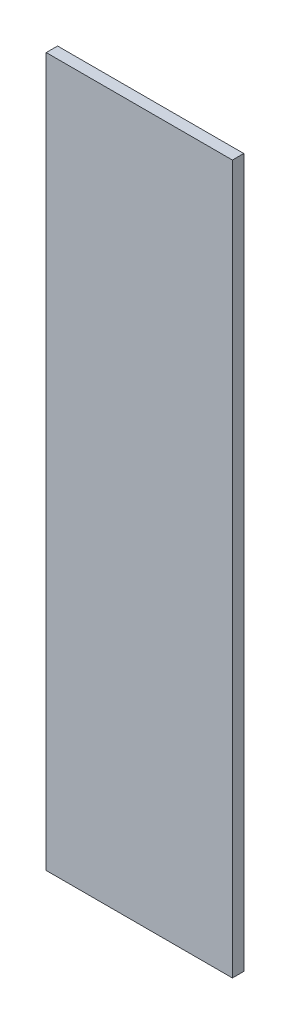
from build123d import *

# Parameters (mm, degrees)
SKETCH1_W           = 82
SKETCH1_H           = 312
BOSS_EXTRUDE1_DEPTH = 5


with BuildPart() as part:
    # Sketch1 → Boss-Extrude1 (new body)
    with BuildSketch(Plane.XY):
        Rectangle(SKETCH1_W, SKETCH1_H)
    extrude(amount=BOSS_EXTRUDE1_DEPTH)


solid = part.part
